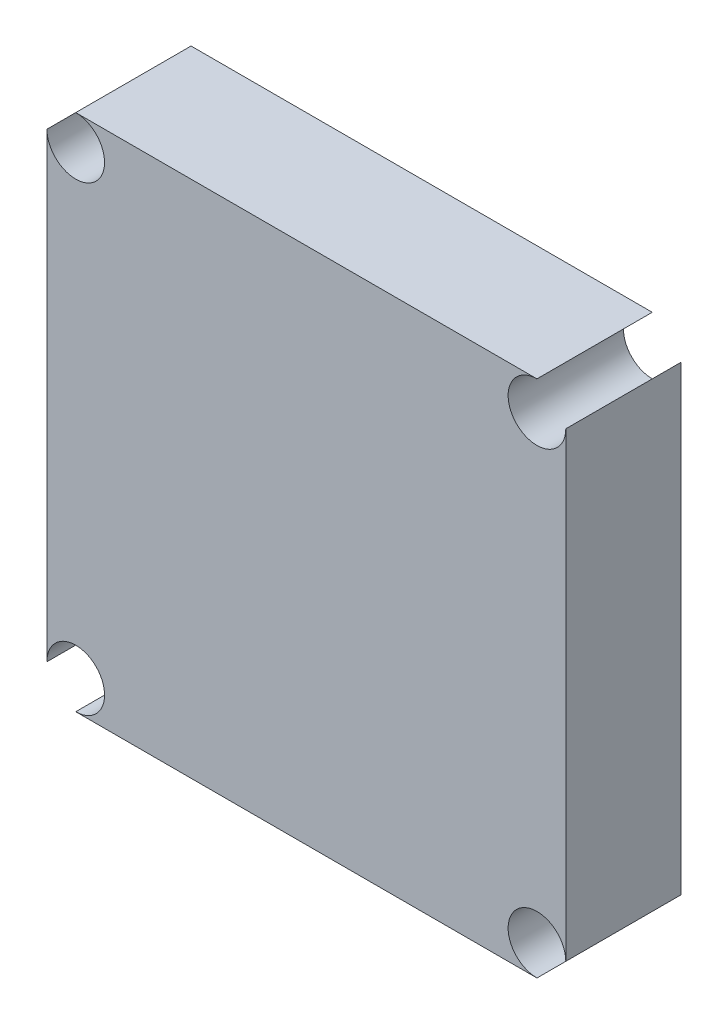
from build123d import *

# Parameters (mm, degrees)
BOSS_EXTRUDE1_DEPTH = 4


with BuildPart() as part:
    # Sketch1 → Boss-Extrude1 (new, symmetric)
    with BuildSketch(Plane.XY):
        with BuildLine():
            ThreePointArc((-14, -16), (-14.585786438, -17.414213562), (-16, -18))
            Line((-16, -18), (15.999999973, -18))
            ThreePointArc((15.999999973, -18), (14.585786447, -14.585786428), (18, -16))
            Line((18, -16), (18, 16))
            ThreePointArc((18, 16), (14.585786438, 14.585786438), (16, 18))
            Line((16, 18), (-16, 18))
            ThreePointArc((-16, 18), (-14.585786438, 17.414213562), (-14, 16))
            ThreePointArc((-14, 16), (-16, 14), (-18, 16))
            Line((-18, 16), (-18, -16))
            ThreePointArc((-18, -16), (-16, -14), (-14, -16))
        make_face()
    extrude(amount=BOSS_EXTRUDE1_DEPTH, both=True)


solid = part.part
